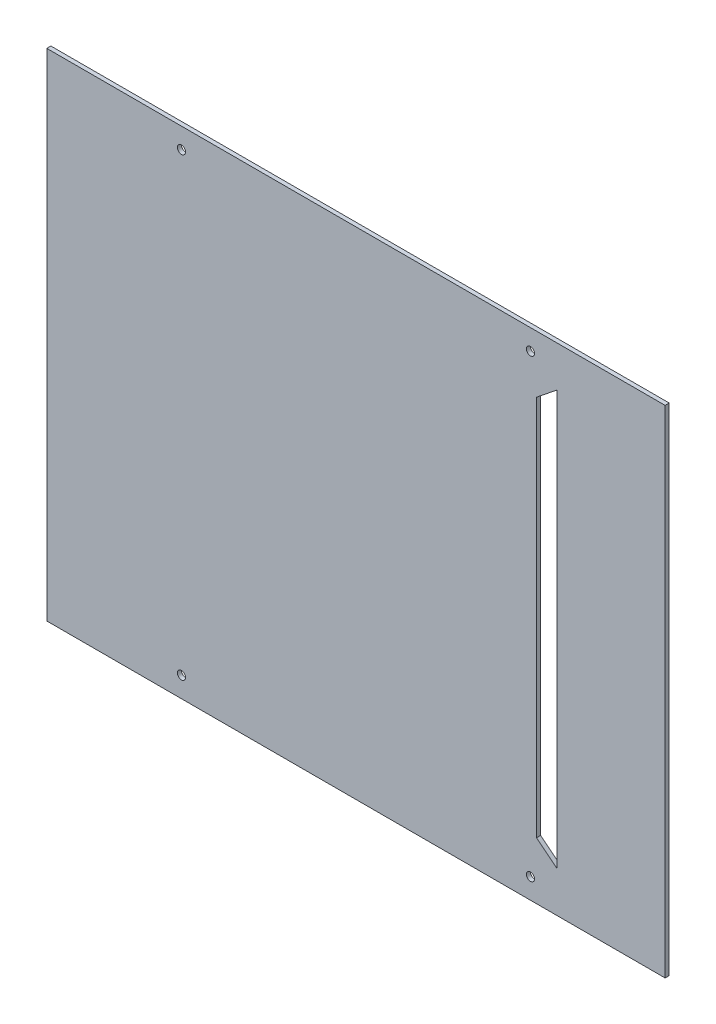
from build123d import *

# Parameters (mm, degrees)
SKETCH1_W           = 303
SKETCH1_H           = 243
SKETCH1_R           = 2
BOSS_EXTRUDE1_DEPTH = 2


with BuildPart() as part:
    # Sketch1 → Boss-Extrude1 (new body)
    with BuildSketch(Plane.XY):
        Rectangle(SKETCH1_W, SKETCH1_H)
        with Locations((-85.5, 111.5)):
            Circle(SKETCH1_R, mode=Mode.SUBTRACT)
        with Locations((85.5, 111.5)):
            Circle(SKETCH1_R, mode=Mode.SUBTRACT)
        with Locations((85.5, -111.5)):
            Circle(SKETCH1_R, mode=Mode.SUBTRACT)
        with Locations((-85.5, -111.5)):
            Circle(SKETCH1_R, mode=Mode.SUBTRACT)
        Polygon((98.5, 101.5), (98.5, -101.5), (88.5, -93.48019802), (88.5, 93.48019802), align=None, mode=Mode.SUBTRACT)
    extrude(amount=BOSS_EXTRUDE1_DEPTH)


solid = part.part
